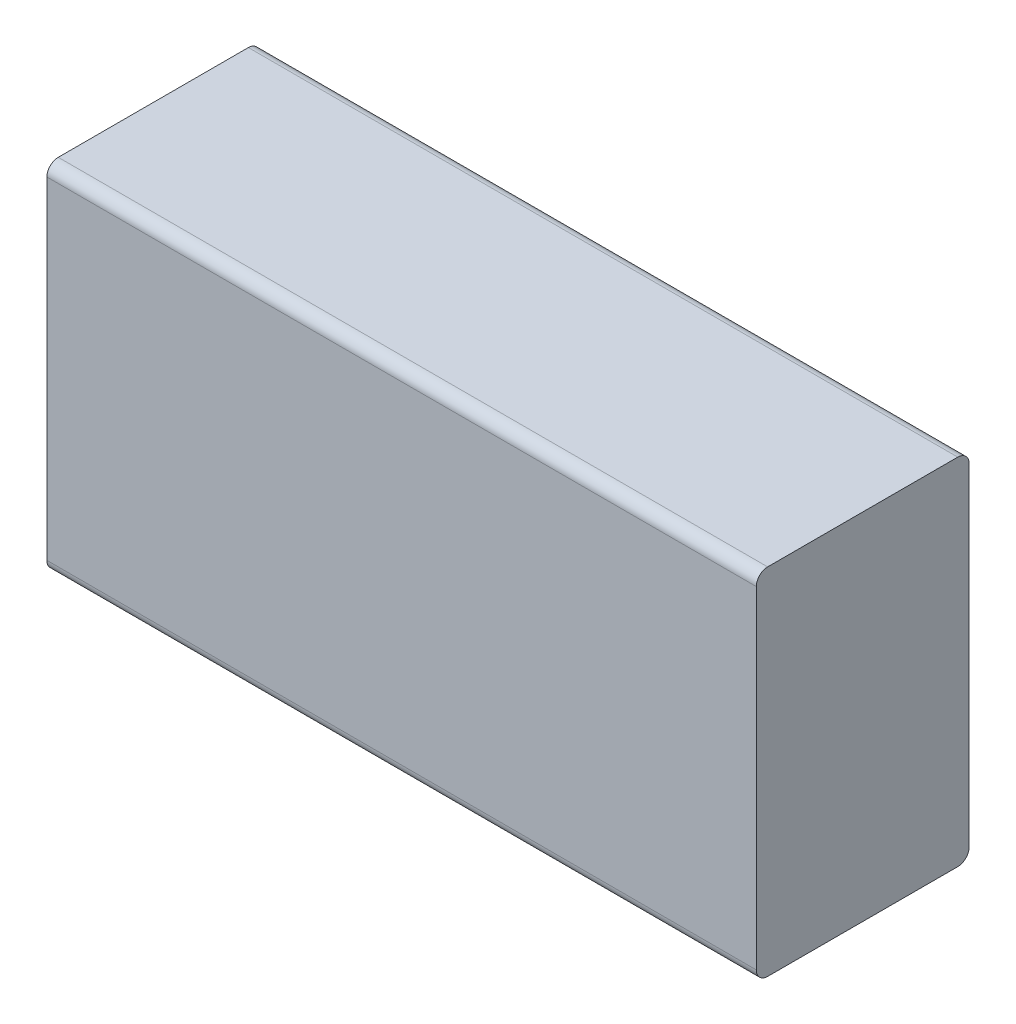
from build123d import *

# Parameters (mm, degrees)
EXTRUDE1_DEPTH = 3
SKETCH2_W      = 10
SKETCH2_H      = 5
EXTRUDE2_DEPTH = 3
FILLET1_R      = 0.16


with BuildPart() as part:
    # Sketch1 → Extrude1 (new body)
    with BuildSketch(Plane.XY):
        with BuildLine():
            Line((0, 2.5), (-7.5, 2.5))
            Line((-7.5, 2.5), (-7.5, -2.5))
            Line((-7.5, -2.5), (0, -2.5))
            ThreePointArc((0, -2.5), (2.5, 0), (0, 2.5))
        make_face()
    extrude(amount=EXTRUDE1_DEPTH)

    # Sketch2 → Extrude2 (add)
    with BuildSketch(Plane.XY):
        with Locations((-2.5, 0)):
            Rectangle(SKETCH2_W, SKETCH2_H)
    extrude(amount=EXTRUDE2_DEPTH)

    # Fillet1
    fillet1_edges = [part.edges().sort_by_distance(p)[0] for p in [
        (-2.5, -2.5, 0),
        (-2.5, -2.5, 3),
        (-2.5, 2.5, 0),
        (-2.5, 2.5, 3),
    ]]
    fillet(fillet1_edges, radius=FILLET1_R)


solid = part.part
